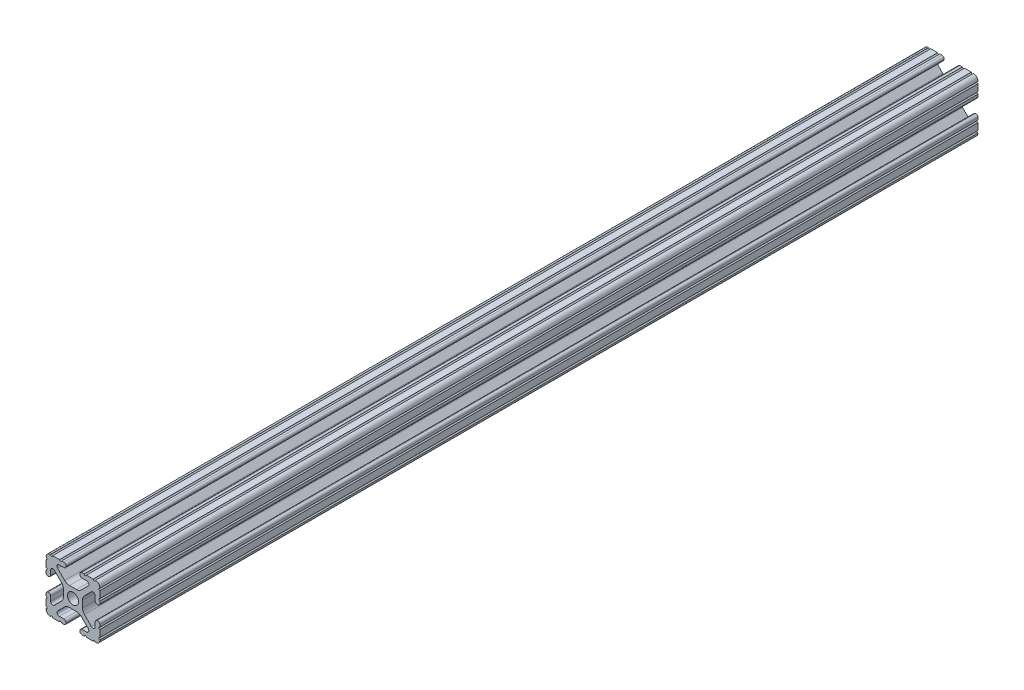
from build123d import *

# Parameters (mm, degrees)
SKETCH1_R           = 2.6035
BOSS_EXTRUDE1_DEPTH = 207.01


with BuildPart() as part:
    # Sketch1 → Boss-Extrude1 (new, symmetric)
    with BuildSketch(Plane.XY):
        with BuildLine():
            Line((-7.179650497, -8.645192506), (-3.952270251, -5.423690499))
            ThreePointArc((-3.952270251, -5.423690499), (-2.922936451, -4.736929036), (-1.709253557, -4.4958))
            Line((-1.709253557, -4.4958), (1.709253557, -4.4958))
            ThreePointArc((1.709253557, -4.4958), (2.922936451, -4.736929036), (3.952270251, -5.423690499))
            Line((3.952270251, -5.423690499), (7.179650497, -8.645192506))
            ThreePointArc((7.179650497, -8.645192506), (7.41473083, -9.822813117), (6.416408329, -10.4902))
            Line((6.416408329, -10.4902), (4.287512407, -10.4902))
            ThreePointArc((4.287512407, -10.4902), (3.54574862, -10.79744862), (3.2385, -11.539212407))
            Line((3.2385, -11.539212407), (3.2385, -11.650987593))
            ThreePointArc((3.2385, -11.650987593), (3.54574862, -12.39275138), (4.287512407, -12.7))
            Line((4.287512407, -12.7), (5.317126718, -12.7))
            ThreePointArc((5.317126718, -12.7), (5.825126718, -12.192), (6.333126718, -12.7))
            Line((6.333126718, -12.7), (9.550443118, -12.7))
            ThreePointArc((9.550443118, -12.7), (10.058366869, -12.192000006), (10.566443095, -12.699847501))
            ThreePointArc((10.566443095, -12.699847501), (12.082537762, -12.08250727), (12.699846982, -10.566399977))
            ThreePointArc((12.699846982, -10.566399977), (12.192000006, -10.058323491), (12.7, -9.5504))
            Line((12.7, -9.5504), (12.7, -6.3330836))
            ThreePointArc((12.7, -6.3330836), (12.192, -5.8250836), (12.7, -5.3170836))
            Line((12.7, -5.3170836), (12.7, -4.287469289))
            ThreePointArc((12.7, -4.287469289), (12.39275138, -3.545705502), (11.650987593, -3.238456882))
            Line((11.650987593, -3.238456882), (11.539212407, -3.238456882))
            ThreePointArc((11.539212407, -3.238456882), (10.79744862, -3.545705502), (10.4902, -4.287469289))
            Line((10.4902, -4.287469289), (10.4902, -6.402089023))
            ThreePointArc((10.4902, -6.402089023), (9.856505071, -7.351067942), (8.737131347, -7.129408934))
            Line((8.737131347, -7.129408934), (5.441005833, -3.840816462))
            ThreePointArc((5.441005833, -3.840816462), (4.750877967, -2.809883091), (4.5085, -1.593185507))
            Line((4.5085, -1.593185507), (4.5085, 1.593185507))
            ThreePointArc((4.5085, 1.593185507), (4.750877967, 2.809883091), (5.441005833, 3.840816462))
            Line((5.441005833, 3.840816462), (8.737131347, 7.129408934))
            ThreePointArc((8.737131347, 7.129408934), (9.856505071, 7.351067942), (10.4902, 6.402089023))
            Line((10.4902, 6.402089023), (10.4902, 4.287469289))
            ThreePointArc((10.4902, 4.287469289), (10.79744862, 3.545705502), (11.539212407, 3.238456882))
            Line((11.539212407, 3.238456882), (11.650987593, 3.238456882))
            ThreePointArc((11.650987593, 3.238456882), (12.39275138, 3.545705502), (12.7, 4.287469289))
            Line((12.7, 4.287469289), (12.7, 5.3170836))
            ThreePointArc((12.7, 5.3170836), (12.192, 5.8250836), (12.7, 6.3330836))
            Line((12.7, 6.3330836), (12.7, 9.5504))
            ThreePointArc((12.7, 9.5504), (12.192000006, 10.058323491), (12.699846982, 10.566399977))
            ThreePointArc((12.699846982, 10.566399977), (12.082537762, 12.08250727), (10.566443095, 12.699847501))
            ThreePointArc((10.566443095, 12.699847501), (10.058366869, 12.192000006), (9.550443118, 12.7))
            Line((9.550443118, 12.7), (6.333126718, 12.7))
            ThreePointArc((6.333126718, 12.7), (5.825126718, 12.192), (5.317126718, 12.7))
            Line((5.317126718, 12.7), (4.287512407, 12.7))
            ThreePointArc((4.287512407, 12.7), (3.54574862, 12.39275138), (3.2385, 11.650987593))
            Line((3.2385, 11.650987593), (3.2385, 11.539212407))
            ThreePointArc((3.2385, 11.539212407), (3.54574862, 10.79744862), (4.287512407, 10.4902))
            Line((4.287512407, 10.4902), (6.476788598, 10.4902))
            ThreePointArc((6.476788598, 10.4902), (7.432222385, 9.85140422), (7.207036008, 8.724370562))
            Line((7.207036008, 8.724370562), (3.898272566, 5.423169045))
            ThreePointArc((3.898272566, 5.423169045), (2.869120213, 4.736787962), (1.655778399, 4.4958))
            Line((1.655778399, 4.4958), (-1.655778399, 4.4958))
            ThreePointArc((-1.655778399, 4.4958), (-2.869120213, 4.736787962), (-3.898272566, 5.423169045))
            Line((-3.898272566, 5.423169045), (-7.207036008, 8.724370562))
            ThreePointArc((-7.207036008, 8.724370562), (-7.432222385, 9.85140422), (-6.476788598, 10.4902))
            Line((-6.476788598, 10.4902), (-4.287512407, 10.4902))
            ThreePointArc((-4.287512407, 10.4902), (-3.54574862, 10.79744862), (-3.2385, 11.539212407))
            Line((-3.2385, 11.539212407), (-3.2385, 11.650987593))
            ThreePointArc((-3.2385, 11.650987593), (-3.54574862, 12.39275138), (-4.287512407, 12.7))
            Line((-4.287512407, 12.7), (-5.317126718, 12.7))
            ThreePointArc((-5.317126718, 12.7), (-5.825126718, 12.192), (-6.333126718, 12.7))
            Line((-6.333126718, 12.7), (-9.550443118, 12.7))
            ThreePointArc((-9.550443118, 12.7), (-10.058366869, 12.192000006), (-10.566443095, 12.699847501))
            ThreePointArc((-10.566443095, 12.699847501), (-12.082537762, 12.08250727), (-12.699846982, 10.566399977))
            ThreePointArc((-12.699846982, 10.566399977), (-12.192000006, 10.058323491), (-12.7, 9.5504))
            Line((-12.7, 9.5504), (-12.7, 6.3330836))
            ThreePointArc((-12.7, 6.3330836), (-12.192, 5.8250836), (-12.7, 5.3170836))
            Line((-12.7, 5.3170836), (-12.7, 4.287469289))
            ThreePointArc((-12.7, 4.287469289), (-12.39275138, 3.545705502), (-11.650987593, 3.238456882))
            Line((-11.650987593, 3.238456882), (-11.539212407, 3.238456882))
            ThreePointArc((-11.539212407, 3.238456882), (-10.79744862, 3.545705502), (-10.4902, 4.287469289))
            Line((-10.4902, 4.287469289), (-10.4902, 6.402089023))
            ThreePointArc((-10.4902, 6.402089023), (-9.856505071, 7.351067942), (-8.737131347, 7.129408934))
            Line((-8.737131347, 7.129408934), (-5.441005833, 3.840816462))
            ThreePointArc((-5.441005833, 3.840816462), (-4.750877967, 2.809883091), (-4.5085, 1.593185507))
            Line((-4.5085, 1.593185507), (-4.5085, -1.593185507))
            ThreePointArc((-4.5085, -1.593185507), (-4.750877967, -2.809883091), (-5.441005833, -3.840816462))
            Line((-5.441005833, -3.840816462), (-8.737131347, -7.129408934))
            ThreePointArc((-8.737131347, -7.129408934), (-9.856505071, -7.351067942), (-10.4902, -6.402089023))
            Line((-10.4902, -6.402089023), (-10.4902, -4.287469289))
            ThreePointArc((-10.4902, -4.287469289), (-10.79744862, -3.545705502), (-11.539212407, -3.238456882))
            Line((-11.539212407, -3.238456882), (-11.650987593, -3.238456882))
            ThreePointArc((-11.650987593, -3.238456882), (-12.39275138, -3.545705502), (-12.7, -4.287469289))
            Line((-12.7, -4.287469289), (-12.7, -5.3170836))
            ThreePointArc((-12.7, -5.3170836), (-12.192, -5.8250836), (-12.7, -6.3330836))
            Line((-12.7, -6.3330836), (-12.7, -9.5504))
            ThreePointArc((-12.7, -9.5504), (-12.192000006, -10.058323491), (-12.699846982, -10.566399977))
            ThreePointArc((-12.699846982, -10.566399977), (-12.082537762, -12.08250727), (-10.566443095, -12.699847501))
            ThreePointArc((-10.566443095, -12.699847501), (-10.058366869, -12.192000006), (-9.550443118, -12.7))
            Line((-9.550443118, -12.7), (-6.333126718, -12.7))
            ThreePointArc((-6.333126718, -12.7), (-5.825126718, -12.192), (-5.317126718, -12.7))
            Line((-5.317126718, -12.7), (-4.287512407, -12.7))
            ThreePointArc((-4.287512407, -12.7), (-3.54574862, -12.39275138), (-3.2385, -11.650987593))
            Line((-3.2385, -11.650987593), (-3.2385, -11.539212407))
            ThreePointArc((-3.2385, -11.539212407), (-3.54574862, -10.79744862), (-4.287512407, -10.4902))
            Line((-4.287512407, -10.4902), (-6.416408329, -10.4902))
            ThreePointArc((-6.416408329, -10.4902), (-7.41473083, -9.822813117), (-7.179650497, -8.645192506))
        make_face()
        Circle(SKETCH1_R, mode=Mode.SUBTRACT)
    extrude(amount=BOSS_EXTRUDE1_DEPTH, both=True)


solid = part.part
